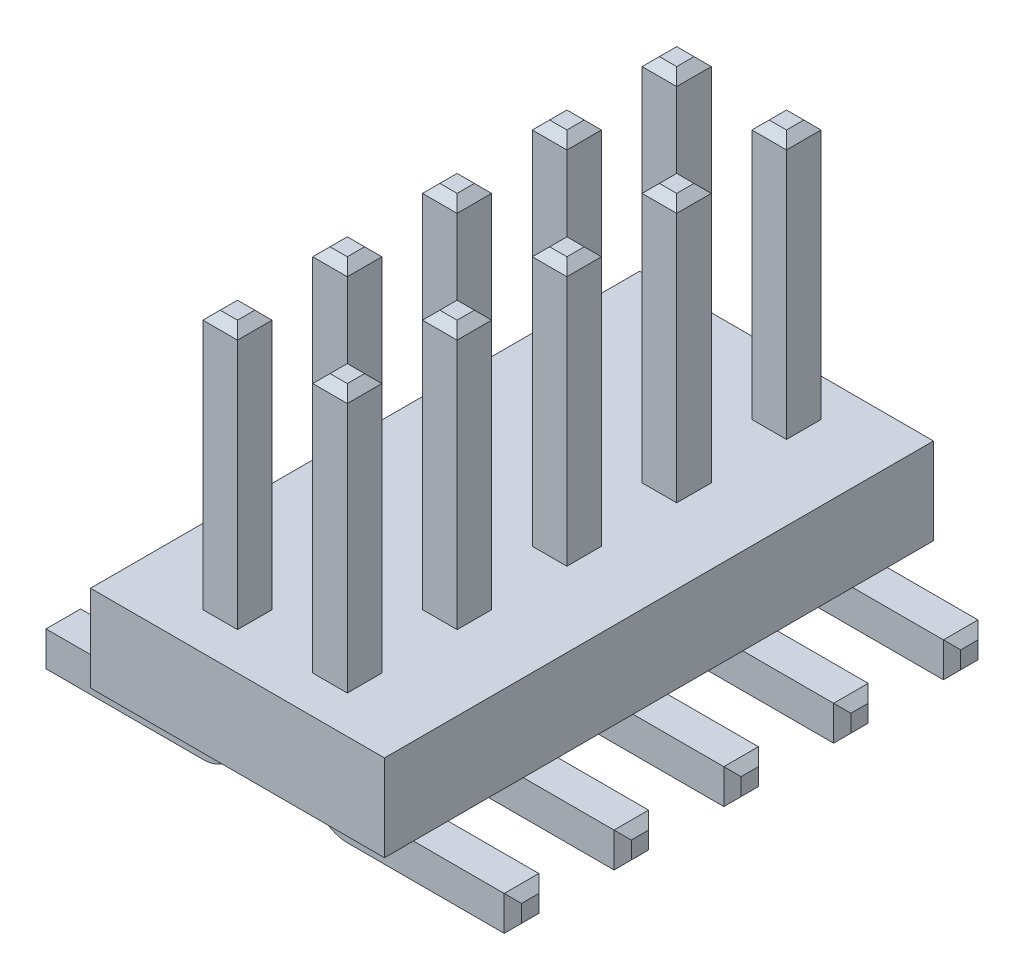
from build123d import *

# Parameters (mm, degrees)
SKIZZE1_W                         = 3.4
SKIZZE1_H                         = 1
AUFSATZ_LINEAR_AUSTRAGEN1_DEPTH   = 1.27
SKIZZE3_W                         = 0.4
SKIZZE3_H                         = 0.4
AUFSATZ_LINEAR_AUSTRAGEN3_DEPTH   = 0.5
SKIZZE4_W                         = 0.4
SKIZZE4_H                         = 0.4
AUFSATZ_LINEAR_AUSTRAGEN4_DEPTH   = 1.915
SKIZZE5_W                         = 0.4
SKIZZE5_H                         = 0.4
AUFSATZ_LINEAR_AUSTRAGEN5_DEPTH   = 1.915
SKIZZE6_W                         = 0.4
SKIZZE6_H                         = 0.4
AUFSATZ_LINEAR_AUSTRAGEN6_DEPTH   = 3
FASE2_SIZE                        = 0.1
VERRUNDUNG1_R                     = 0.1
VERRUNDUNG2_R                     = 0.4
LINEARES_MUSTER1_COUNT            = 5
LINEARES_MUSTER1_PITCH            = 1.27
FASE2_OF_LINEARES_MUSTER1_SIZE    = 0.1
VERRUNDUNG1_OF_LINEARES_MUSTER1_R = 0.1
VERRUNDUNG2_OF_LINEARES_MUSTER1_R = 0.4


with BuildPart() as part:
    # Skizze1 → Aufsatz-Linear austragen1 (new body)
    with BuildSketch(Plane.XY):
        with Locations((1.7, 0.5)):
            Rectangle(SKIZZE1_W, SKIZZE1_H)
    aufsatz_linear_austragen1 = extrude(amount=AUFSATZ_LINEAR_AUSTRAGEN1_DEPTH)

    # Skizze3 → Aufsatz-Linear austragen3 (add)
    with BuildSketch(Plane.XZ):
        with Locations((1.065, 0.635)):
            Rectangle(SKIZZE3_W, SKIZZE3_H)
        with Locations((2.335, 0.635)):
            Rectangle(SKIZZE3_W, SKIZZE3_H)
    aufsatz_linear_austragen3 = extrude(amount=AUFSATZ_LINEAR_AUSTRAGEN3_DEPTH)

    # Skizze4 → Aufsatz-Linear austragen4 (add)
    with BuildSketch(Plane(origin=(2.535, 0, 0), x_dir=(0, 0, -1), z_dir=(1, 0, 0))):
        with Locations((-0.635, -0.3)):
            Rectangle(SKIZZE4_W, SKIZZE4_H)
    aufsatz_linear_austragen4 = extrude(amount=AUFSATZ_LINEAR_AUSTRAGEN4_DEPTH)

    # Skizze5 → Aufsatz-Linear austragen5 (add)
    with BuildSketch(Plane.ZY.offset(-0.865)):
        with Locations((0.635, -0.3)):
            Rectangle(SKIZZE5_W, SKIZZE5_H)
    aufsatz_linear_austragen5 = extrude(amount=AUFSATZ_LINEAR_AUSTRAGEN5_DEPTH)

    # Skizze6 → Aufsatz-Linear austragen6 (add)
    with BuildSketch(Plane(origin=(0, 1, 0), x_dir=(1, 0, 0), z_dir=(0, 1, 0))):
        with Locations((1.065, -0.635)):
            Rectangle(SKIZZE6_W, SKIZZE6_H)
        with Locations((2.335, -0.635)):
            Rectangle(SKIZZE6_W, SKIZZE6_H)
    aufsatz_linear_austragen6 = extrude(amount=AUFSATZ_LINEAR_AUSTRAGEN6_DEPTH)

    # Fase2
    fase2_edges = [part.edges().sort_by_distance(p)[0] for p in [
        (4.45, -0.3, 0.835),
        (4.45, -0.5, 0.635),
        (4.45, -0.3, 0.435),
        (4.45, -0.1, 0.635),
        (-1.05, -0.3, 0.835),
        (-1.05, -0.1, 0.635),
        (-1.05, -0.3, 0.435),
        (-1.05, -0.5, 0.635),
        (1.265, 4, 0.635),
        (1.065, 4, 0.435),
        (0.865, 4, 0.635),
        (1.065, 4, 0.835),
        (2.535, 4, 0.635),
        (2.335, 4, 0.435),
        (2.135, 4, 0.635),
        (2.335, 4, 0.835),
    ]]
    chamfer(fase2_edges, length=FASE2_SIZE)

    # Verrundung1
    verrundung1_edges = [part.edges().sort_by_distance(p)[0] for p in [
        (0.865, -0.1, 0.635),
        (2.535, -0.1, 0.635),
    ]]
    fillet(verrundung1_edges, radius=VERRUNDUNG1_R - 0.0001)  # a hair under: the kernel refuses the full size

    # Verrundung2
    verrundung2_edges = [part.edges().sort_by_distance(p)[0] for p in [
        (1.265, -0.5, 0.635),
        (2.135, -0.5, 0.635),
    ]]
    fillet(verrundung2_edges, radius=VERRUNDUNG2_R)

    # Lineares Muster1: Aufsatz-Linear austragen1, Aufsatz-Linear austragen3, Aufsatz-Linear austragen4, Aufsatz-Linear austragen5, Aufsatz-Linear austragen6 ×5
    with Locations(*[(0, 0, i * LINEARES_MUSTER1_PITCH) for i in range(1, LINEARES_MUSTER1_COUNT)]):
        add(aufsatz_linear_austragen1)
        add(aufsatz_linear_austragen3)
        add(aufsatz_linear_austragen4)
        add(aufsatz_linear_austragen5)
        add(aufsatz_linear_austragen6)

    # Fase2 of Lineares Muster1
    fase2_of_lineares_muster1_edges = [part.edges().sort_by_distance(p)[0] for p in [
        (4.45, -0.3, 2.105),
        (4.45, -0.5, 1.905),
        (4.45, -0.3, 1.705),
        (4.45, -0.1, 1.905),
        (-1.05, -0.3, 2.105),
        (-1.05, -0.1, 1.905),
        (-1.05, -0.3, 1.705),
        (-1.05, -0.5, 1.905),
        (1.265, 4, 1.905),
        (1.065, 4, 1.705),
        (0.865, 4, 1.905),
        (1.065, 4, 2.105),
        (2.535, 4, 1.905),
        (2.335, 4, 1.705),
        (2.135, 4, 1.905),
        (2.335, 4, 2.105),
        (4.45, -0.3, 3.375),
        (4.45, -0.5, 3.175),
        (4.45, -0.3, 2.975),
        (4.45, -0.1, 3.175),
        (-1.05, -0.3, 3.375),
        (-1.05, -0.1, 3.175),
        (-1.05, -0.3, 2.975),
        (-1.05, -0.5, 3.175),
        (1.265, 4, 3.175),
        (1.065, 4, 2.975),
        (0.865, 4, 3.175),
        (1.065, 4, 3.375),
        (2.535, 4, 3.175),
        (2.335, 4, 2.975),
        (2.135, 4, 3.175),
        (2.335, 4, 3.375),
        (4.45, -0.3, 4.645),
        (4.45, -0.5, 4.445),
        (4.45, -0.3, 4.245),
        (4.45, -0.1, 4.445),
        (-1.05, -0.3, 4.645),
        (-1.05, -0.1, 4.445),
        (-1.05, -0.3, 4.245),
        (-1.05, -0.5, 4.445),
        (1.265, 4, 4.445),
        (1.065, 4, 4.245),
        (0.865, 4, 4.445),
        (1.065, 4, 4.645),
        (2.535, 4, 4.445),
        (2.335, 4, 4.245),
        (2.135, 4, 4.445),
        (2.335, 4, 4.645),
        (4.45, -0.3, 5.915),
        (4.45, -0.5, 5.715),
        (4.45, -0.3, 5.515),
        (4.45, -0.1, 5.715),
        (-1.05, -0.3, 5.915),
        (-1.05, -0.1, 5.715),
        (-1.05, -0.3, 5.515),
        (-1.05, -0.5, 5.715),
        (1.265, 4, 5.715),
        (1.065, 4, 5.515),
        (0.865, 4, 5.715),
        (1.065, 4, 5.915),
        (2.535, 4, 5.715),
        (2.335, 4, 5.515),
        (2.135, 4, 5.715),
        (2.335, 4, 5.915),
    ]]
    chamfer(fase2_of_lineares_muster1_edges, length=FASE2_OF_LINEARES_MUSTER1_SIZE)

    # Verrundung1 of Lineares Muster1
    verrundung1_of_lineares_muster1_edges = [part.edges().sort_by_distance(p)[0] for p in [
        (0.865, -0.1, 1.905),
        (2.535, -0.1, 1.905),
        (0.865, -0.1, 3.175),
        (2.535, -0.1, 3.175),
        (0.865, -0.1, 4.445),
        (2.535, -0.1, 4.445),
        (0.865, -0.1, 5.715),
        (2.535, -0.1, 5.715),
    ]]
    fillet(verrundung1_of_lineares_muster1_edges, radius=VERRUNDUNG1_OF_LINEARES_MUSTER1_R - 0.0001)  # a hair under: the kernel refuses the full size

    # Verrundung2 of Lineares Muster1
    verrundung2_of_lineares_muster1_edges = [part.edges().sort_by_distance(p)[0] for p in [
        (1.265, -0.5, 1.905),
        (2.135, -0.5, 1.905),
        (1.265, -0.5, 3.175),
        (2.135, -0.5, 3.175),
        (1.265, -0.5, 4.445),
        (2.135, -0.5, 4.445),
        (1.265, -0.5, 5.715),
        (2.135, -0.5, 5.715),
    ]]
    fillet(verrundung2_of_lineares_muster1_edges, radius=VERRUNDUNG2_OF_LINEARES_MUSTER1_R)


solid = part.part
